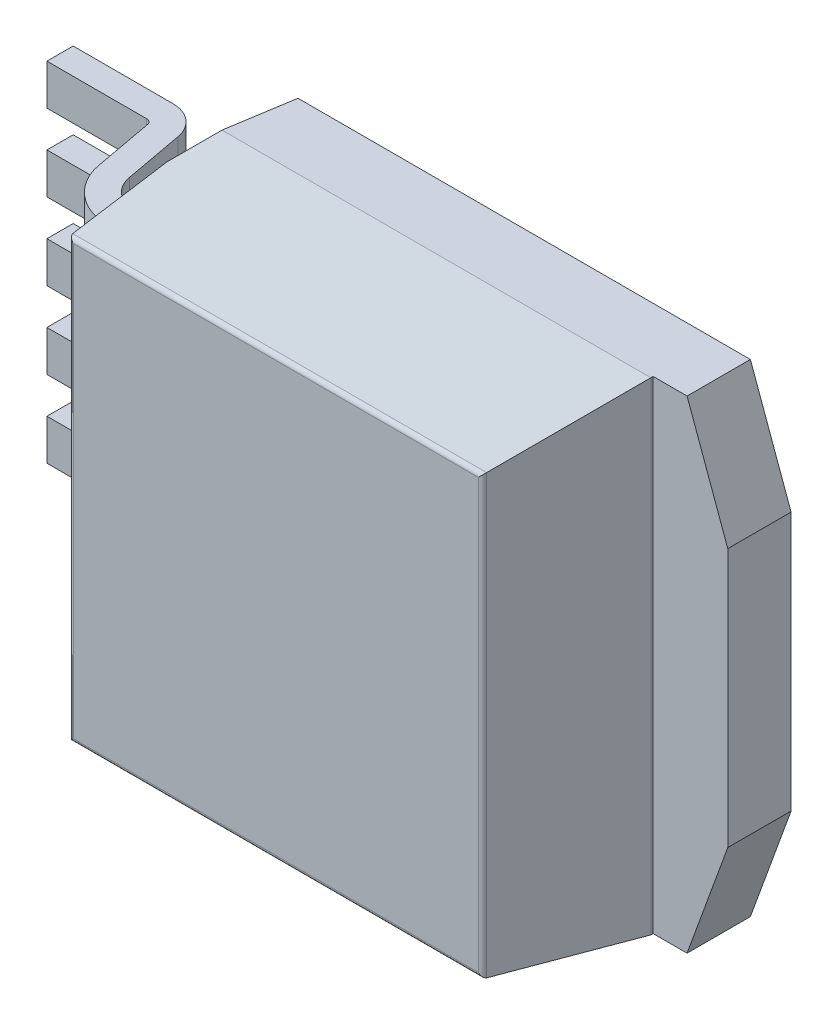
from build123d import *
from OCP.BRepFilletAPI import BRepFilletAPI_MakeChamfer

# Parameters (mm, degrees)
SKETCH_1_W             = 9.65
SKETCH_1_H             = 10.67
EXTRUDE_1_DEPTH        = 4.67
SKETCH_2_W             = 1.4
SKETCH_2_H             = 10.67
EXTRUDE_2_DEPTH        = 1.65
CHAMFER_1_SIZE         = 0.9
CHAMFER_1_SIZE2        = 2.472729678
CHAMFER_2_SIZE         = 3.22
CHAMFER_2_SIZE2        = 0.509997898
CHAMFER_3_SIZE         = 2.5
CHAMFER_3_SIZE2        = 0.395961101
FILLET_1_R             = 0.1
EXTRUDE_2_2_DEPTH      = 0.45
PATTERN_LINEAR_1_COUNT = 5
PATTERN_LINEAR_1_PITCH = 1.7


with BuildPart() as part:
    # Эскиз1 → Бобышка-Вытянуть1 (new body)
    with BuildSketch(Plane.XY):
        Rectangle(SKETCH_1_W, SKETCH_1_H)
    extrude(amount=EXTRUDE_1_DEPTH)

    # Эскиз2 → Extrude 2 (add)
    with BuildSketch(Plane(origin=(4.825, 0, 0), x_dir=(0, 0, -1), z_dir=(1, 0, 0))):
        with Locations((-0.7, 0)):
            Rectangle(SKETCH_2_W, SKETCH_2_H)
    extrude(amount=EXTRUDE_2_DEPTH)

    # Фаска1: one chamfer whose edges measure the first distance from different faces: ONE call of the kernel's chamfer builder (chamfer() names one face for all edges)
    chamfer_1_edges_1 = [part.edges().sort_by_distance(p)[0] for p in [
        (6.475, 5.335, 0.7),
    ]]
    chamfer_1_side_1 = [part.faces().sort_by_distance(p)[0] for p in [
        (0.275490496, 5.335, 2.255278414),
    ]]
    chamfer_1_edges_2 = [part.edges().sort_by_distance(p)[0] for p in [
        (6.475, -5.335, 0.7),
    ]]
    chamfer_1_side_2 = [part.faces().sort_by_distance(p)[0] for p in [
        (0.275490496, -5.335, 2.255278414),
    ]]
    chamfer_1 = BRepFilletAPI_MakeChamfer(part.part.solid().wrapped)
    for e in chamfer_1_edges_1:
        chamfer_1.Add(CHAMFER_1_SIZE, CHAMFER_1_SIZE2, e.wrapped, chamfer_1_side_1[0].wrapped)  # the first distance lies on this face
    for e in chamfer_1_edges_2:
        chamfer_1.Add(CHAMFER_1_SIZE, CHAMFER_1_SIZE2, e.wrapped, chamfer_1_side_2[0].wrapped)  # the first distance lies on this face
    add(Compound.cast(chamfer_1.Shape()), mode=Mode.REPLACE)

    # Фаска2: one chamfer whose edges measure the first distance from different faces: ONE call of the kernel's chamfer builder (chamfer() names one face for all edges)
    chamfer_2_edges_1 = [part.edges().sort_by_distance(p)[0] for p in [
        (0, -5.335, 4.67),
    ]]
    chamfer_2_side_1 = [part.faces().sort_by_distance(p)[0] for p in [
        (0.118398369, -5.335, 2.29777282),
    ]]
    chamfer_2_edges_2 = [part.edges().sort_by_distance(p)[0] for p in [
        (0, 5.335, 4.67),
    ]]
    chamfer_2_side_2 = [part.faces().sort_by_distance(p)[0] for p in [
        (0.118398369, 5.335, 2.29777282),
    ]]
    chamfer_2_edges_3 = [part.edges().sort_by_distance(p)[0] for p in [
        (4.825, 0, 4.67),
    ]]
    chamfer_2_side_3 = [part.faces().sort_by_distance(p)[0] for p in [
        (4.825, 0, 3.035),
    ]]
    chamfer_2 = BRepFilletAPI_MakeChamfer(part.part.solid().wrapped)
    for e in chamfer_2_edges_1:
        chamfer_2.Add(CHAMFER_2_SIZE, CHAMFER_2_SIZE2, e.wrapped, chamfer_2_side_1[0].wrapped)  # the first distance lies on this face
    for e in chamfer_2_edges_2:
        chamfer_2.Add(CHAMFER_2_SIZE, CHAMFER_2_SIZE2, e.wrapped, chamfer_2_side_2[0].wrapped)  # the first distance lies on this face
    for e in chamfer_2_edges_3:
        chamfer_2.Add(CHAMFER_2_SIZE, CHAMFER_2_SIZE2, e.wrapped, chamfer_2_side_3[0].wrapped)  # the first distance lies on this face
    add(Compound.cast(chamfer_2.Shape()), mode=Mode.REPLACE)

    # Фаска3
    chamfer_3_edges = [part.edges().sort_by_distance(p)[0] for p in [
        (-4.825, 0, 0),
    ]]
    chamfer_3_side = [part.faces().sort_by_distance(p)[0] for p in [
        (-4.825, 0, 2.292002655),
    ]]
    chamfer(chamfer_3_edges, length=CHAMFER_3_SIZE, length2=CHAMFER_3_SIZE2, reference=chamfer_3_side[0])

    # Скругление1
    fillet_1_edges = [part.edges().sort_by_distance(p)[0] for p in [
        (-4.825, 0, 4.67),
        (4.315002102, 0, 4.67),
        (-0.254998949, 4.825002102, 4.67),
        (-0.254998949, -4.825002102, 4.67),
    ]]
    fillet(fillet_1_edges, radius=FILLET_1_R)

    # Эскиз6 → Extrude 2 2 (add, symmetric)
    with BuildSketch(Plane(origin=(0, 3.4, 0), x_dir=(-1, 0, 0), z_dir=(0, 1, 0))):
        with BuildLine():
            Line((4.825, 2.47), (5.572169718, 2.47))
            ThreePointArc((5.572169718, 2.47), (6.020070605, 2.307944974), (6.26058695, 1.896813701))
            Line((6.26058695, 1.896813701), (6.50441305, 0.573186299))
            ThreePointArc((6.50441305, 0.573186299), (6.744929395, 0.162055026), (7.192830282, 0))
            Line((7.192830282, 0), (9.4, 0))
            Line((9.4, 0), (9.4, 0.58))
            Line((9.4, 0.58), (7.192830282, 0.58))
            ThreePointArc((7.192830282, 0.58), (7.116047273, 0.607780862), (7.074815899, 0.678260508))
            Line((7.074815899, 0.678260508), (6.830989799, 2.00188791))
            ThreePointArc((6.830989799, 2.00188791), (6.391188483, 2.75367081), (5.572169718, 3.05))
            Line((5.572169718, 3.05), (4.825, 3.05))
            Line((4.825, 3.05), (4.825, 2.47))
        make_face()
    extrude_2_2 = extrude(amount=EXTRUDE_2_2_DEPTH, both=True)

    # Линейный массив1: Extrude 2 2 ×5
    with Locations(*[(0, -i * PATTERN_LINEAR_1_PITCH, 0) for i in range(1, PATTERN_LINEAR_1_COUNT)]):
        add(extrude_2_2)


with BuildPart() as part_1:
    # Move Body 1: read off the stored shape, not the designer's step
    # Move Body 1: moved
    add(part.part.moved(Location((8.295, -3.4, 0))))


solid = part_1.part
